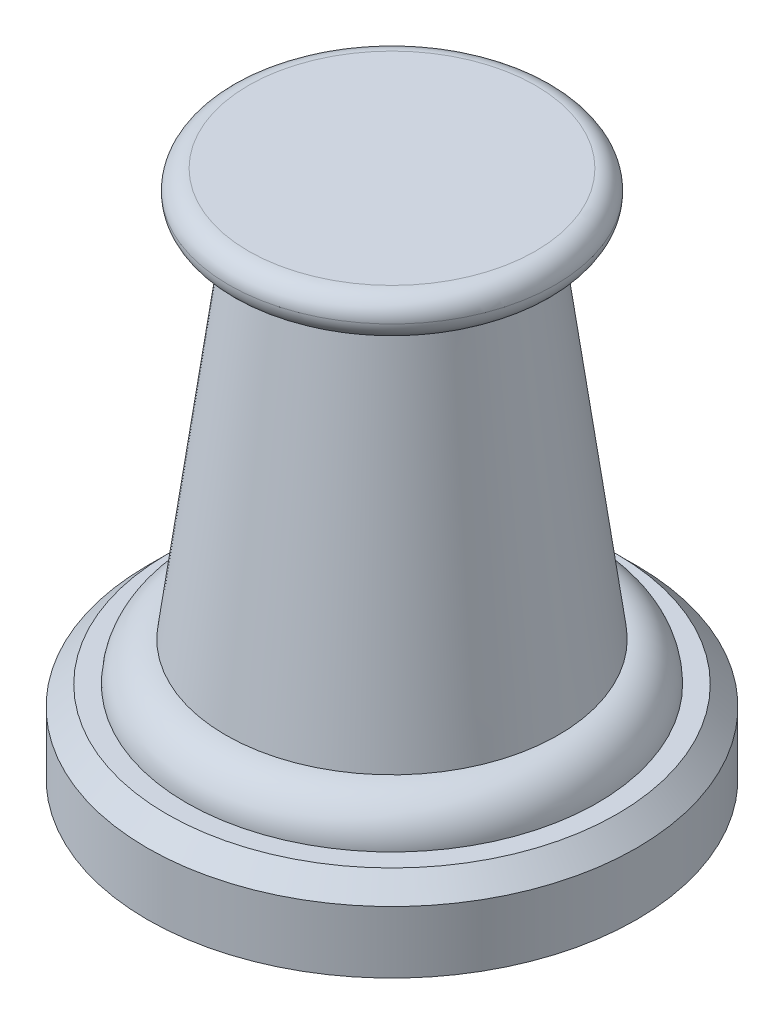
from build123d import *

# Parameters (mm, degrees)
CHAMFER1_SIZE = 0.762
FILLET2_R     = 1.524
FILLET3_R     = 0.762


with BuildPart() as part:
    # Sketch3 → Revolve1 (revolve)
    with BuildSketch(Plane.XY, mode=Mode.PRIVATE) as revolve1_sk:
        Polygon((0, 0), (-9.525, 0), (-9.525, 3.175), (-8.001, 3.175), (-8.001, 4.699), (-6.477, 4.699), (-4.572, 19.05), (-6.35, 19.05), (-6.35, 20.574), (0, 20.574), align=None)
    revolve(revolve1_sk.sketch.rotate(Axis((0, 20.574, 0), (0, -1, 0)), 270), axis=Axis((0, 20.574, 0), (0, -1, 0)))

    # Chamfer1
    chamfer1_edges = [part.edges().sort_by_distance(p)[0] for p in [
        (0, 3.175, -9.525),
    ]]
    chamfer(chamfer1_edges, length=CHAMFER1_SIZE)

    # Fillet2
    fillet2_edges = [part.edges().sort_by_distance(p)[0] for p in [
        (0, 4.699, -8.001),
    ]]
    fillet(fillet2_edges, radius=FILLET2_R - 0.0001)  # a hair under: the kernel refuses the full size

    # Fillet3
    fillet3_edges = [part.edges().sort_by_distance(p)[0] for p in [
        (0, 20.574, -6.35),
        (0, 19.05, -6.35),
    ]]
    fillet(fillet3_edges, radius=FILLET3_R - 0.0001)  # a hair under: the kernel refuses the full size


solid = part.part
